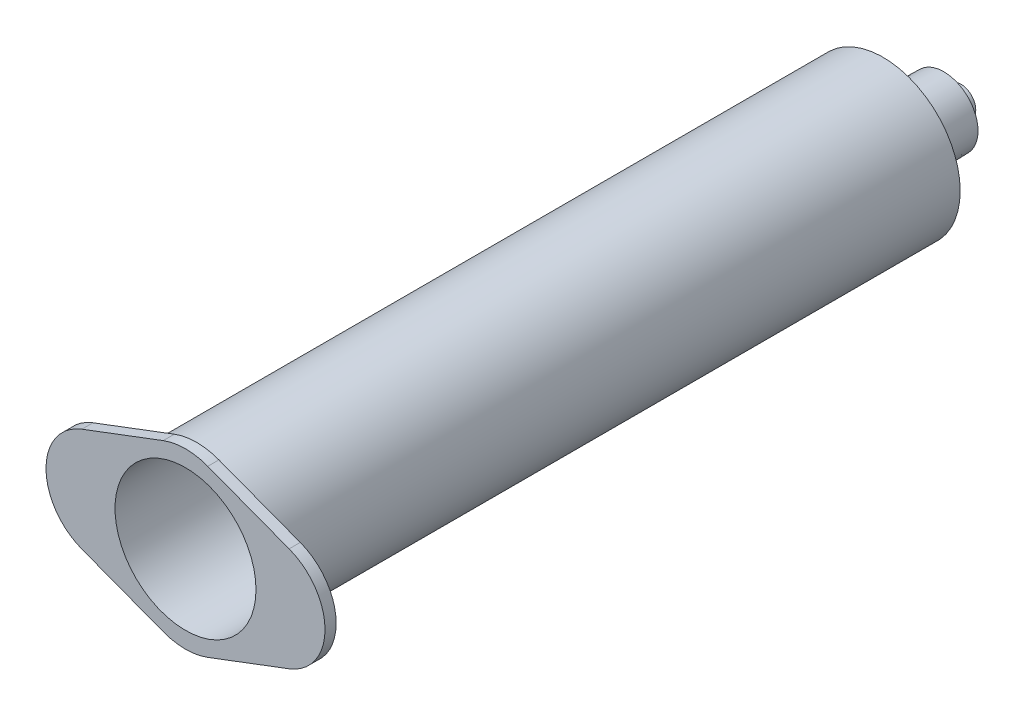
from build123d import *

# Parameters (mm, degrees)
SKETCH1_R           = 10.4
SKETCH1_R_2         = 9.5
BOSS_EXTRUDE1_DEPTH = 92.5
SKETCH3_R           = 9.5
BOSS_EXTRUDE2_DEPTH = 1.5


with BuildPart() as part:
    # Sketch1 → Boss-Extrude1 (new body)
    with BuildSketch(Plane.XY):
        Circle(SKETCH1_R)
        Circle(SKETCH1_R_2, mode=Mode.SUBTRACT)
    extrude(amount=BOSS_EXTRUDE1_DEPTH)

    # Sketch2 → Revolve1 (revolve)
    with BuildSketch(Plane(origin=(0, 0, 0), x_dir=(0, 0, -1), z_dir=(1, 0, 0))):
        Polygon((0, 10.4), (1.2, 4.8), (8.2, 4.6), (8.2, 3.8), (2.2, 3.8), (2.2, 2), (10.5, 2), (10.5, 0.97), (1.2, 0.97), (1.2, 3.9), (0, 9.5), align=None)
    revolve(axis=Axis((0, 0, 0), (0, 0, -1)))

    # Sketch3 → Boss-Extrude2 (add)
    with BuildSketch(Plane.XY.offset(92.5)):
        with BuildLine():
            Line((-3, 11.151145138), (-13.965196483, 7))
            ThreePointArc((-13.965196483, 7), (-18.8, 0), (-13.965196483, -7))
            Line((-13.965196483, -7), (-3, -11.151145138))
            ThreePointArc((-3, -11.151145138), (0, -11.7), (3, -11.151145138))
            Line((3, -11.151145138), (13.965196483, -7))
            ThreePointArc((13.965196483, -7), (18.8, 0), (13.965196483, 7))
            Line((13.965196483, 7), (3, 11.151145138))
            ThreePointArc((3, 11.151145138), (0, 11.7), (-3, 11.151145138))
        make_face()
        Circle(SKETCH3_R, mode=Mode.SUBTRACT)
    extrude(amount=BOSS_EXTRUDE2_DEPTH)


solid = part.part
